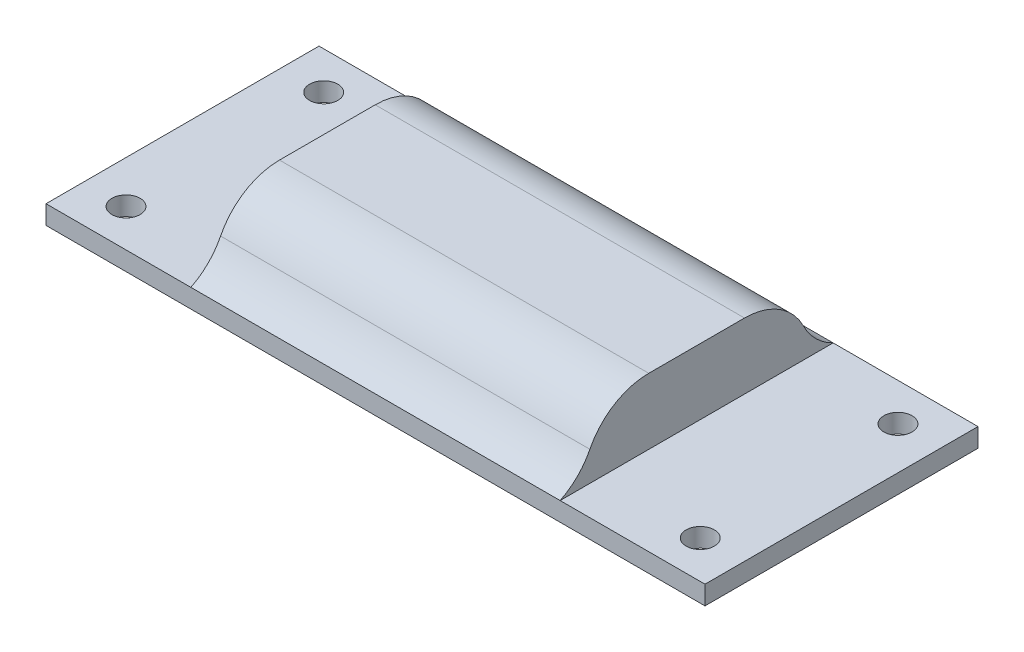
from build123d import *

# Parameters (mm, degrees)
SKETCH1_W           = 70
SKETCH1_H           = 29
SKETCH1_R           = 1.5
BOSS_EXTRUDE1_DEPTH = 2
SKETCH3_W           = 39.225392784
SKETCH3_H           = 21.196798794
BOSS_EXTRUDE2_DEPTH = 7
FILLET2_R           = 7
FILLET3_R           = 7


with BuildPart() as part:
    # Sketch1 → Boss-Extrude1 (new body)
    with BuildSketch(Plane(origin=(0, 0, 0), x_dir=(1, 0, 0), z_dir=(0, 1, 0))):
        Rectangle(SKETCH1_W, SKETCH1_H)
        with Locations(Location((-30.499583195, 10.498163925, 0), (0, 0, 270))):
            Circle(SKETCH1_R, mode=Mode.SUBTRACT)
        with Locations(Location((30.500416805, 10.498163925, 0), (0, 0, 270))):
            Circle(SKETCH1_R, mode=Mode.SUBTRACT)
        with Locations(Location((-30.499583195, -10.501836075, 0), (0, 0, 270))):
            Circle(SKETCH1_R, mode=Mode.SUBTRACT)
        with Locations(Location((30.500416805, -10.501836075, 0), (0, 0, 270))):
            Circle(SKETCH1_R, mode=Mode.SUBTRACT)
    extrude(amount=BOSS_EXTRUDE1_DEPTH)

    # Sketch3 → Boss-Extrude2 (add)
    with BuildSketch(Plane(origin=(0, 2, 0), x_dir=(1, 0, 0), z_dir=(0, 1, 0))):
        Rectangle(SKETCH3_W, SKETCH3_H)
    extrude(amount=BOSS_EXTRUDE2_DEPTH)

    # Fillet2
    # the kernel refuses this fillet: 7 mm, written as the material it adds along each edge
    with BuildSketch(Plane(origin=(-19.612696392, 2, 10.598399397), x_dir=(0, 0, 1), z_dir=(1, 0, 0)), Plane(origin=(19.612696392, 2, -10.598399397), x_dir=(0, 0, -1), z_dir=(-1, 0, 0))) as fillet2_piece_1:
        with BuildLine():
            CenterArc((7, -6.276935652), FILLET2_R, 116.271709478, 63.728290522)
            Line((0, -6.276935652), (-0.14, -6.276935652))
            Line((-0.14, -6.276935652), (-0.14, 0))
            Line((-0.14, 0), (0, 0.14))
            ThreePointArc((0, 0.14), (1.950800302, 0.14), (3.839632616, 0.125538713))
            Line((3.839632616, 0.125538713), (3.901600603, 0))
        make_face()
    extrude(amount=39.225392784)

    # Fillet3
    fillet3_edges = [part.edges().sort_by_distance(p)[0] for p in [
        (0, 9, -10.598399397),
        (0, 9, 10.598399397),
    ]]
    fillet(fillet3_edges, radius=FILLET3_R)


solid = part.part
